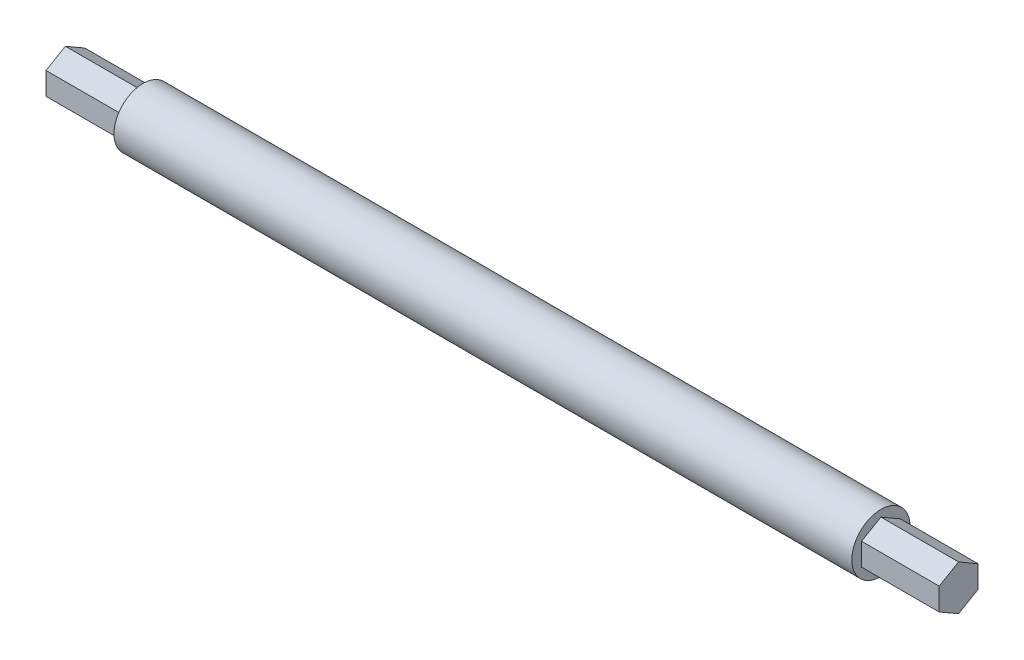
from build123d import *

# Parameters (mm, degrees)
SKETCH_1_W      = 380
SKETCH_1_H      = 15
EXTRUDE_1_DEPTH = 40
EXTRUDE_2_DEPTH = 40


with BuildPart() as part:
    # Эскиз1 → Повернуть1 (revolve)
    with BuildSketch(Plane.XY):
        with Locations((0, 7.5)):
            Rectangle(SKETCH_1_W, SKETCH_1_H)
    revolve(axis=Axis((-233.547445255, 0, 0), (1, 0, 0)))

    # Эскиз2 → Бобышка-Вытянуть1 (add)
    with BuildSketch(Plane.ZY.offset(190)):
        Polygon((0, 11.547005384), (-10, 5.773502692), (-10, -5.773502692), (0, -11.547005384), (10, -5.773502692), (10, 5.773502692), align=None)
    extrude(amount=EXTRUDE_1_DEPTH)

    # Эскиз3 → Бобышка-Вытянуть2 (add)
    with BuildSketch(Plane(origin=(190, 0, 0), x_dir=(0, 0, -1), z_dir=(1, 0, 0))):
        Polygon((10, 5.773502692), (0, 11.547005384), (-10, 5.773502692), (-10, -5.773502692), (0, -11.547005384), (10, -5.773502692), align=None)
    extrude(amount=EXTRUDE_2_DEPTH)


solid = part.part
